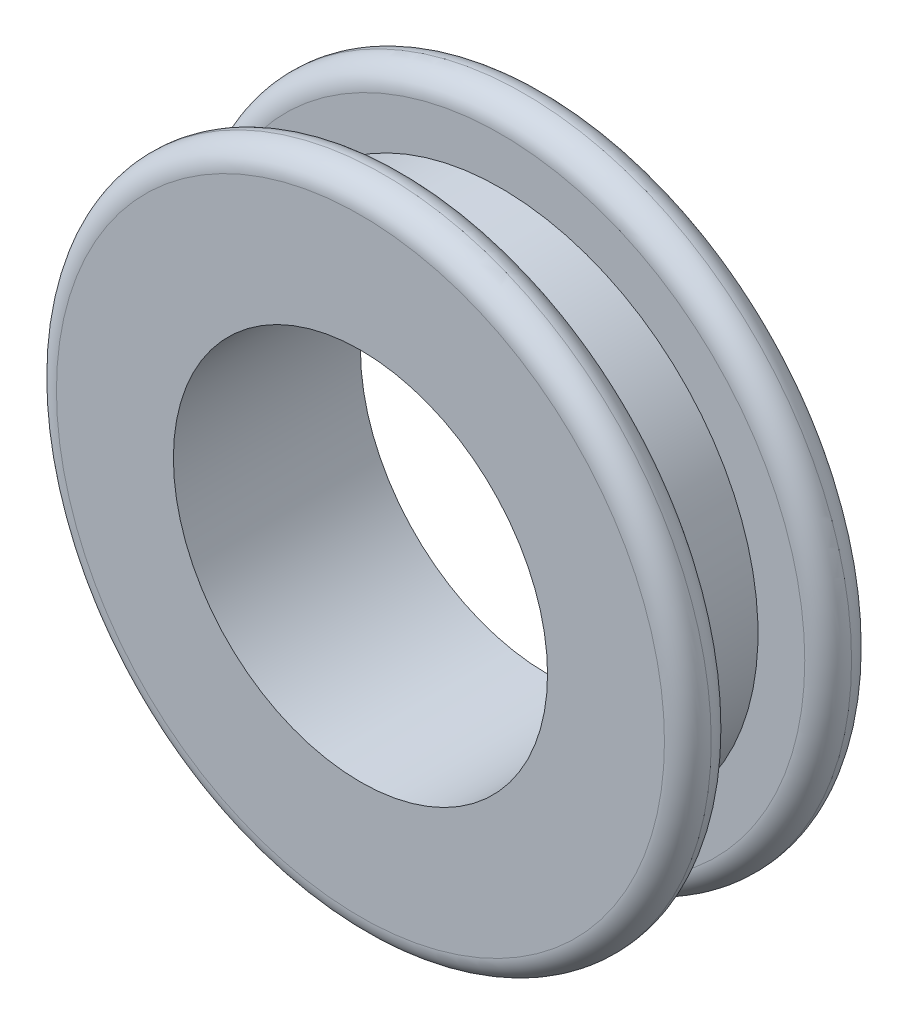
from build123d import *

# Parameters (mm, degrees)
SKETCH_1_R      = 7
SKETCH_1_R_2    = 4
EXTRUDE_1_DEPTH = 4
SKETCH_2_W      = 2
SKETCH_2_H      = 1.5
FILLET_1_R      = 0.5


with BuildPart() as part:
    # 草图1 → 凸台-拉伸1 (new body)
    with BuildSketch(Plane.XY):
        Circle(SKETCH_1_R)
        Circle(SKETCH_1_R_2, mode=Mode.SUBTRACT)
    extrude(amount=EXTRUDE_1_DEPTH)

    # 草图2 → 切除-旋转1 (revolve, cut)
    with BuildSketch(Plane(origin=(0, 0, 0), x_dir=(0, 0, -1), z_dir=(1, 0, 0)), mode=Mode.PRIVATE) as cut_revolve_1_sk:
        with Locations((-2, 6.25)):
            Rectangle(SKETCH_2_W, SKETCH_2_H)
    revolve(cut_revolve_1_sk.sketch.rotate(Axis((0, 0, -1.510874211), (0, 0, 1)), 90), axis=Axis((0, 0, -1.510874211), (0, 0, 1)), mode=Mode.SUBTRACT)

    # 圆角1
    fillet_1_edges = [part.edges().sort_by_distance(p)[0] for p in [
        (-7, 0, 1),
        (-7, 0, 3),
        (-7, 0, 0),
        (-7, 0, 4),
    ]]
    fillet(fillet_1_edges, radius=FILLET_1_R - 0.0001)  # a hair under: the kernel refuses the full size


solid = part.part
